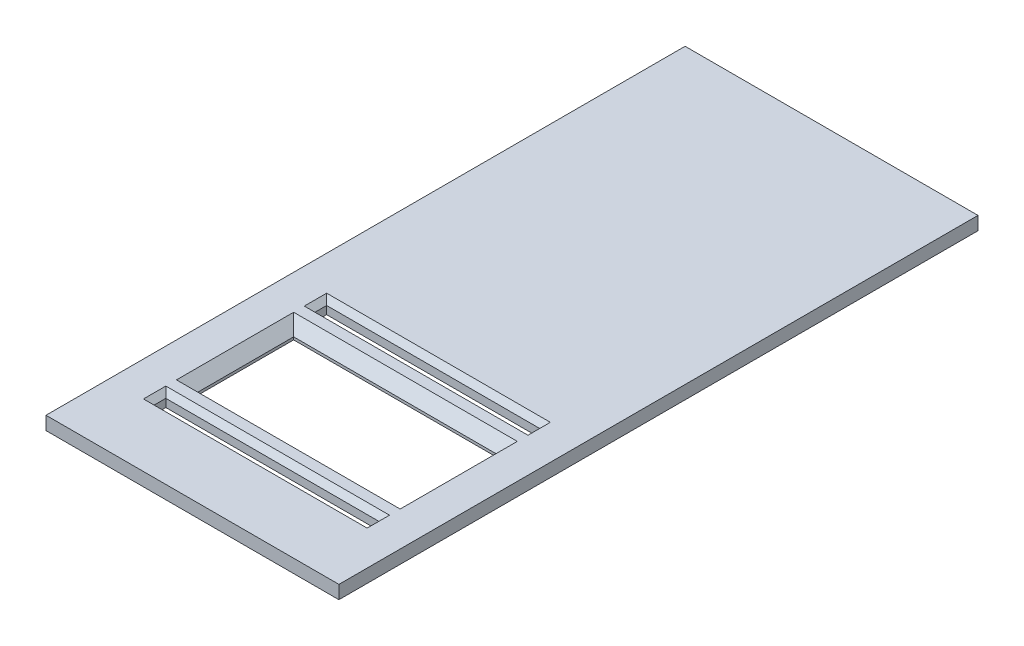
from build123d import *

# Parameters (mm, degrees)
SKETCH1_W           = 139.7
SKETCH1_H           = 304.8
BOSS_EXTRUDE1_DEPTH = 6.35
SKETCH2_W           = 96.52
SKETCH2_H           = 45.72
MAIN_HOLE_DEPTH     = 264.5058728
SKETCH3_W           = 101.6
SKETCH3_H           = 5.588
NEOPIXEL_DEPTH      = 264.5058728
SKETCH5_W           = 134.62
SKETCH5_H           = 299.72
SKETCH5_W_2         = 129.54
SKETCH5_H_2         = 294.64
BOSS_EXTRUDE2_DEPTH = 2.54
CHAMFER1_SIZE       = 2.54
CHAMFER2_SIZE       = 5.08


with BuildPart() as part:
    # Sketch1 → Boss-Extrude1 (new body)
    with BuildSketch(Plane(origin=(0, 0, 0), x_dir=(1, 0, 0), z_dir=(0, 1, 0))):
        with Locations((0, 101.6)):
            Rectangle(SKETCH1_W, SKETCH1_H)
    extrude(amount=BOSS_EXTRUDE1_DEPTH)

    # Sketch2 → Main Hole (cut, through all)
    with BuildSketch(Plane(origin=(0, 6.35, 0), x_dir=(1, 0, 0), z_dir=(0, 1, 0))):
        with Locations((0, 22.86)):
            Rectangle(SKETCH2_W, SKETCH2_H)
    extrude(amount=-MAIN_HOLE_DEPTH, mode=Mode.SUBTRACT)

    # Sketch3 → NeoPixel (cut, through all)
    with BuildSketch(Plane(origin=(0, 6.35, 0), x_dir=(1, 0, 0), z_dir=(0, 1, 0))):
        with Locations((0, 61.214)):
            Rectangle(SKETCH3_W, SKETCH3_H)
    neopixel = extrude(amount=-NEOPIXEL_DEPTH, mode=Mode.SUBTRACT)

    # Mirror2: NeoPixel across plane
    add(neopixel.mirror(Plane.XY.offset(-22.86)), mode=Mode.SUBTRACT)

    # Sketch5 → Boss-Extrude2 (add)
    with BuildSketch(Plane.XZ):
        with Locations((0, -101.6)):
            Rectangle(SKETCH5_W, SKETCH5_H)
        with Locations((0, -101.6)):
            Rectangle(SKETCH5_W_2, SKETCH5_H_2, mode=Mode.SUBTRACT)
    extrude(amount=BOSS_EXTRUDE2_DEPTH)

    # Chamfer1
    chamfer1_edges = [part.edges().sort_by_distance(p)[0] for p in [
        (50.8, 6.35, 15.494),
        (0, 6.35, 18.288),
        (-50.8, 6.35, 15.494),
        (0, 6.35, 12.7),
        (-50.8, 6.35, -61.214),
        (0, 6.35, -58.42),
        (50.8, 6.35, -61.214),
        (0, 6.35, -64.008),
    ]]
    chamfer(chamfer1_edges, length=CHAMFER1_SIZE)

    # Chamfer2
    chamfer2_edges = [part.edges().sort_by_distance(p)[0] for p in [
        (48.26, 6.35, -22.86),
        (0, 6.35, 0),
        (-48.26, 6.35, -22.86),
        (0, 6.35, -45.72),
    ]]
    chamfer(chamfer2_edges, length=CHAMFER2_SIZE)


solid = part.part
